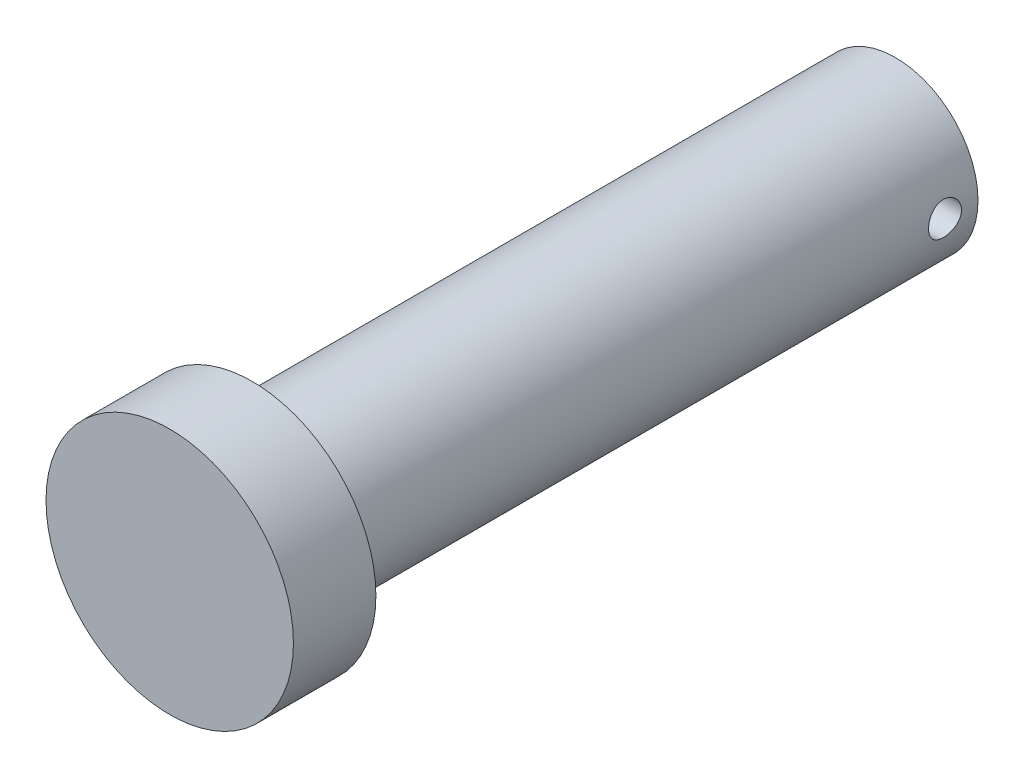
from build123d import *

# Parameters (mm, degrees)
SKETCH1_R               = 5
BOSS_EXTRUDE1_DEPTH     = 44
SKETCH2_R               = 7.5
BOSS_EXTRUDE2_DEPTH     = 5
CUT_EXTRUDE1_DEPTH      = 5
CUT_EXTRUDE1_DEPTH_BACK = 5
SKETCH3_R               = 1


with BuildPart() as part:
    # Sketch1 → Boss-Extrude1 (new body)
    with BuildSketch(Plane.XY):
        Circle(SKETCH1_R)
    extrude(amount=BOSS_EXTRUDE1_DEPTH)

    # Sketch2 → Boss-Extrude2 (add)
    with BuildSketch(Plane.XY.offset(44)):
        Circle(SKETCH2_R)
    extrude(amount=-BOSS_EXTRUDE2_DEPTH)

    # Sketch3 → Cut-Extrude1 (cut, two sides: drawn at the far end of the back side and taken through both)
    with BuildSketch(Plane(origin=(0, 0, 0), x_dir=(0, 0, -1), z_dir=(1, 0, 0)).offset(-CUT_EXTRUDE1_DEPTH_BACK)):
        with Locations((-2, 0)):
            Circle(SKETCH3_R)
    extrude(amount=CUT_EXTRUDE1_DEPTH + CUT_EXTRUDE1_DEPTH_BACK, mode=Mode.SUBTRACT)


solid = part.part
